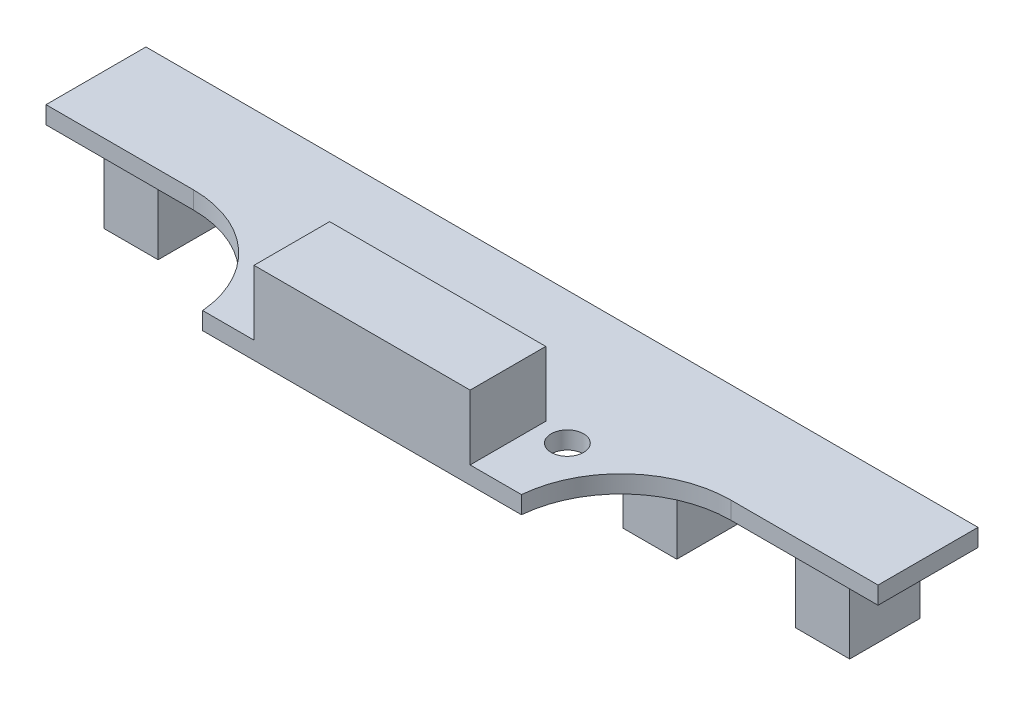
from build123d import *

# Parameters (mm, degrees)
SKETCH1_W           = 5
SKETCH1_H           = 6.5
SKETCH1_W_2         = 29.5
SKETCH1_H_2         = 9.25
BOSS_EXTRUDE1_DEPTH = 1.62
FILLET1_R           = 10.16
SKETCH1_3_W         = 5
SKETCH1_3_H         = 6.5
BOSS_EXTRUDE2_DEPTH = 7
SKETCH2_R           = 1.5
CUT_EXTRUDE1_DEPTH  = 1.62
SKETCH3_W           = 20
SKETCH3_H           = 7
BOSS_EXTRUDE3_DEPTH = 6


with BuildPart() as part:
    # Sketch1 → Boss-Extrude1 (new body)
    # profile 1 of 7: a face of its own
    with BuildSketch(Plane(origin=(0, 0, 0), x_dir=(1, 0, 0), z_dir=(0, 1, 0))):
        Polygon((-38.5, 4.625), (-14.75, 4.625), (14.75, 4.625), (38.5, 4.625), (38.5, 13.875), (-38.5, 13.875), align=None)
        with Locations((-31.9999868, 9.25)):
            Rectangle(SKETCH1_W, SKETCH1_H, mode=Mode.SUBTRACT)
        with Locations((-15.9999934, 9.25)):
            Rectangle(SKETCH1_W, SKETCH1_H, mode=Mode.SUBTRACT)
        with Locations((0, 9.25)):
            Rectangle(SKETCH1_W, SKETCH1_H, mode=Mode.SUBTRACT)
        with Locations((15.9999934, 9.25)):
            Rectangle(SKETCH1_W, SKETCH1_H, mode=Mode.SUBTRACT)
        with Locations((31.9999868, 9.25)):
            Rectangle(SKETCH1_W, SKETCH1_H, mode=Mode.SUBTRACT)
    # profile 2 of 7: a face of its own
    with BuildSketch(Plane(origin=(0, 0, 0), x_dir=(1, 0, 0), z_dir=(0, 1, 0))):
        with Locations((-31.9999868, 9.25)):
            Rectangle(SKETCH1_W, SKETCH1_H)
    # profile 3 of 7: a face of its own
    with BuildSketch(Plane(origin=(0, 0, 0), x_dir=(1, 0, 0), z_dir=(0, 1, 0))):
        with Locations((-15.9999934, 9.25)):
            Rectangle(SKETCH1_W, SKETCH1_H)
    # profile 4 of 7: a face of its own
    with BuildSketch(Plane(origin=(0, 0, 0), x_dir=(1, 0, 0), z_dir=(0, 1, 0))):
        Rectangle(SKETCH1_W_2, SKETCH1_H_2)
    # profile 5 of 7: a face of its own
    with BuildSketch(Plane(origin=(0, 0, 0), x_dir=(1, 0, 0), z_dir=(0, 1, 0))):
        with Locations((0, 9.25)):
            Rectangle(SKETCH1_W, SKETCH1_H)
    # profile 6 of 7: a face of its own
    with BuildSketch(Plane(origin=(0, 0, 0), x_dir=(1, 0, 0), z_dir=(0, 1, 0))):
        with Locations((15.9999934, 9.25)):
            Rectangle(SKETCH1_W, SKETCH1_H)
    # profile 7 of 7: a face of its own
    with BuildSketch(Plane(origin=(0, 0, 0), x_dir=(1, 0, 0), z_dir=(0, 1, 0))):
        with Locations((31.9999868, 9.25)):
            Rectangle(SKETCH1_W, SKETCH1_H)
    extrude(amount=BOSS_EXTRUDE1_DEPTH)

    # Fillet1
    # the kernel refuses this fillet: 10.16 mm, written as the material it adds along each edge
    with BuildSketch(Plane(origin=(14.75, 0, -4.625), x_dir=(0, 0, 1), z_dir=(0, 1, 0))) as fillet1_piece_1:
        with BuildLine():
            CenterArc((10.16, 10.119164985), FILLET1_R, 180, 84.861306661)
            Line((0, 10.119164985), (-0.2032, 10.119164985))
            Line((-0.2032, 10.119164985), (-0.2032, 0))
            Line((-0.2032, 0), (0, -0.2032))
            ThreePointArc((0, -0.2032), (4.625, -0.2032), (9.2318, -0.2023833))
            Line((9.2318, -0.2023833), (9.25, 0))
        make_face()
    extrude(amount=1.62)
    with BuildSketch(Plane(origin=(-14.75, 0, -4.625), x_dir=(-1, 0, 0), z_dir=(0, 1, 0))) as fillet1_piece_2:
        with BuildLine():
            CenterArc((10.119164985, 10.16), FILLET1_R, 185.138693339, 84.861306661)
            Line((0, 9.25), (-0.2023833, 9.2318))
            ThreePointArc((-0.2023833, 9.2318), (-0.2032, 4.625), (-0.2032, 0))
            Line((-0.2032, 0), (0, -0.2032))
            Line((0, -0.2032), (10.119164985, -0.2032))
            Line((10.119164985, -0.2032), (10.119164985, 0))
        make_face()
    extrude(amount=1.62)

    # Sketch1<3> → Boss-Extrude2 (add)
    with BuildSketch(Plane(origin=(0, 0, 0), x_dir=(1, 0, 0), z_dir=(0, 1, 0))):
        with Locations((31.9999868, 9.25)):
            Rectangle(SKETCH1_3_W, SKETCH1_3_H)
        with Locations((15.9999934, 9.25)):
            Rectangle(SKETCH1_3_W, SKETCH1_3_H)
        with Locations((0, 9.25)):
            Rectangle(SKETCH1_3_W, SKETCH1_3_H)
        with Locations((-15.9999934, 9.25)):
            Rectangle(SKETCH1_3_W, SKETCH1_3_H)
        with Locations((-31.9999868, 9.25)):
            Rectangle(SKETCH1_3_W, SKETCH1_3_H)
    extrude(amount=-BOSS_EXTRUDE2_DEPTH)

    # Sketch2 → Cut-Extrude1 (cut)
    with BuildSketch(Plane(origin=(0, 1.62, 0), x_dir=(1, 0, 0), z_dir=(0, 1, 0))):
        with Locations(Location((-12.749999979, 1.624999898, 0), (0, 0, 270))):
            Circle(SKETCH2_R)
        with Locations(Location((12.749999979, 1.624999898, 0), (0, 0, 270))):
            Circle(SKETCH2_R)
    extrude(amount=-CUT_EXTRUDE1_DEPTH, mode=Mode.SUBTRACT)

    # Sketch3 → Boss-Extrude3 (add)
    with BuildSketch(Plane(origin=(0, 1.62, 0), x_dir=(1, 0, 0), z_dir=(0, 1, 0))):
        with Locations((0, -1.125)):
            Rectangle(SKETCH3_W, SKETCH3_H)
    extrude(amount=BOSS_EXTRUDE3_DEPTH)


solid = part.part
